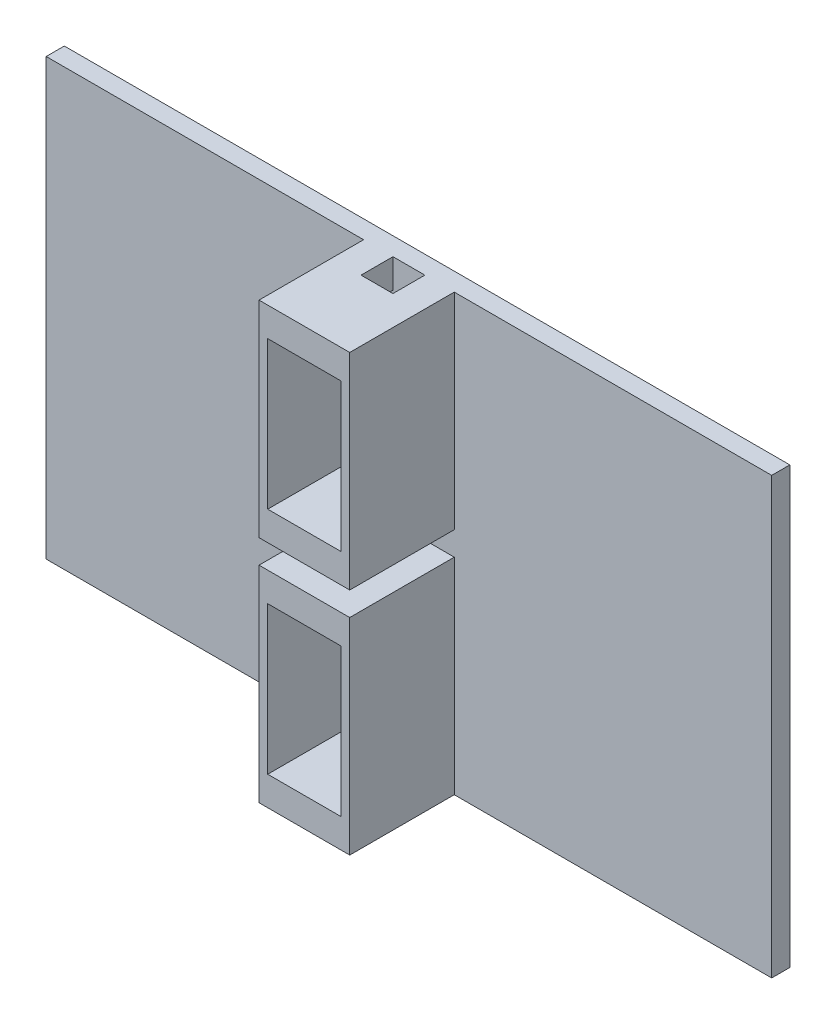
from build123d import *

# Parameters (mm, degrees)
SKETCH1_W           = 200
SKETCH1_H           = 120
BOSS_EXTRUDE1_DEPTH = 5
SKETCH2_W           = 25
SKETCH2_H           = 56.72
BOSS_EXTRUDE2_DEPTH = 28.82
SKETCH3_W           = 20.22
SKETCH3_H           = 40.72
CUT_EXTRUDE1_DEPTH  = 28.82
SKETCH4_W           = 8.8
SKETCH4_H           = 8.8
CUT_EXTRUDE2_DEPTH  = 19.82
SKETCH5_W           = 8.8
SKETCH5_H           = 8.8
CUT_EXTRUDE3_DEPTH  = 19.82


with BuildPart() as part:
    # Sketch1 → Boss-Extrude1 (new body)
    with BuildSketch(Plane.XY):
        Rectangle(SKETCH1_W, SKETCH1_H)
    boss_extrude1 = extrude(amount=BOSS_EXTRUDE1_DEPTH)

    # Sketch2 → Boss-Extrude2 (add)
    with BuildSketch(Plane.XY.offset(5)):
        with Locations((0, 31.64)):
            Rectangle(SKETCH2_W, SKETCH2_H)
    boss_extrude2 = extrude(amount=BOSS_EXTRUDE2_DEPTH)

    # Sketch3 → Cut-Extrude1 (cut)
    with BuildSketch(Plane.XY.offset(33.82)):
        with Locations((0, 31.64)):
            Rectangle(SKETCH3_W, SKETCH3_H)
    cut_extrude1 = extrude(amount=-CUT_EXTRUDE1_DEPTH, mode=Mode.SUBTRACT)

    # Sketch4 → Cut-Extrude2 (cut)
    with BuildSketch(Plane.XZ.offset(-52)):
        with Locations((0, 9.4)):
            Rectangle(SKETCH4_W, SKETCH4_H)
    extrude(amount=-CUT_EXTRUDE2_DEPTH, mode=Mode.SUBTRACT)

    # Mirror1: Boss-Extrude1, Boss-Extrude2, Cut-Extrude1 across plane
    add(boss_extrude1.mirror(Plane.ZX))
    add(boss_extrude2.mirror(Plane.ZX))
    add(cut_extrude1.mirror(Plane.ZX), mode=Mode.SUBTRACT)

    # Sketch5 → Cut-Extrude3 (cut)
    with BuildSketch(Plane(origin=(0, -52, 0), x_dir=(1, 0, 0), z_dir=(0, 1, 0))):
        with Locations((0, -9.4)):
            Rectangle(SKETCH5_W, SKETCH5_H)
    extrude(amount=-CUT_EXTRUDE3_DEPTH, mode=Mode.SUBTRACT)


solid = part.part
